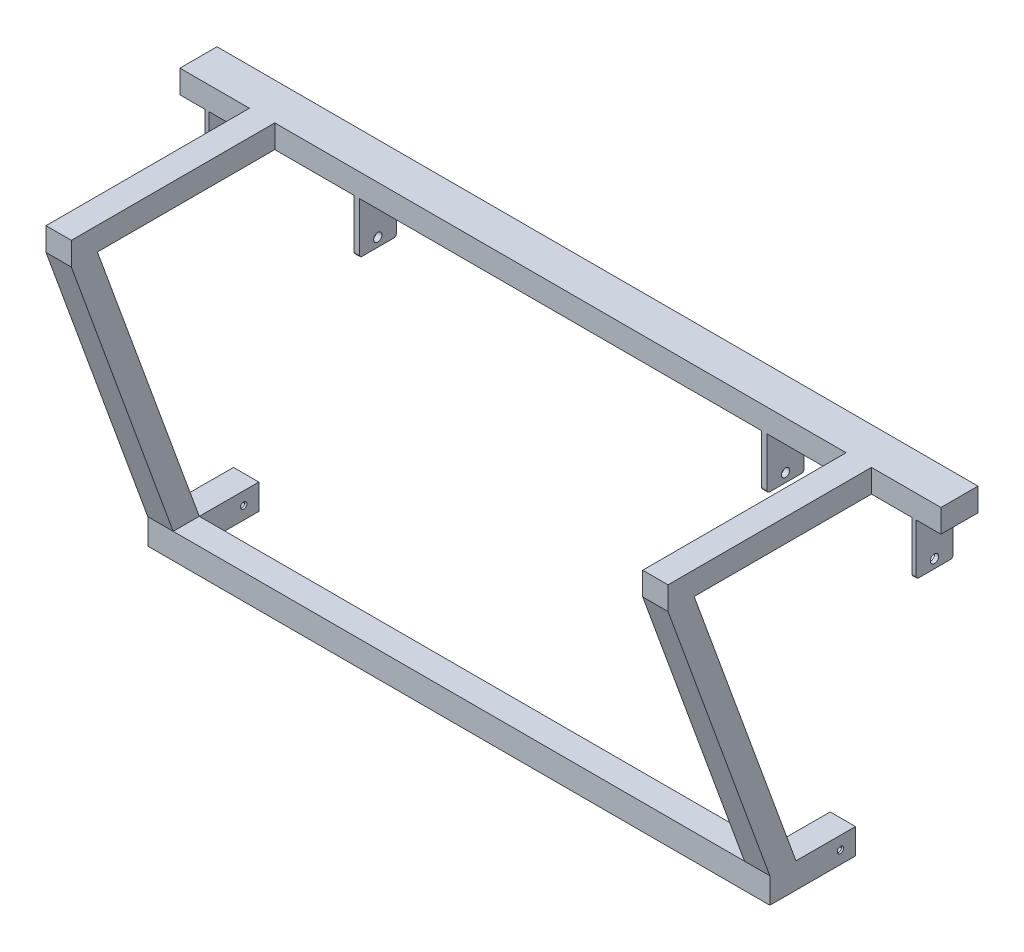
from build123d import *

# Parameters (mm, degrees)
SKETCH1_W            = 1150
SKETCH1_H            = 56
BOSS_EXTRUDE1_DEPTH  = 35
SKETCH2_W            = 38.3
SKETCH2_H            = 35
BOSS_EXTRUDE2_DEPTH  = 268
BOSS_EXTRUDE3_DEPTH  = 38.3
BOSS_EXTRUDE4_DEPTH  = 38.3
SKETCH5_W            = 38.3
SKETCH5_H            = 39.42449842
BOSS_EXTRUDE5_DEPTH  = 38.5
BOSS_EXTRUDE6_DEPTH  = 901.7
SKETCH8_W            = 38.3
SKETCH8_H            = 38.5
BOSS_EXTRUDE7_DEPTH  = 90
SHELL2_START         = -467
SHELL2_OUTLINE_W     = 29
SHELL2_OUTLINE_H     = 50
SHELL2_DEPTH         = 934
SHELL2_2_DEPTH       = 32.3
SHELL2_START_2       = 434.7
SHELL2_3_DEPTH       = 32.3
SHELL2_START_3       = -575
SHELL2_4_OUTLINE_W   = 29
SHELL2_4_OUTLINE_H   = 50
SHELL2_4_DEPTH       = 1147
SKETCH13_W           = 50
SKETCH13_H           = 29
BOSS_EXTRUDE8_DEPTH  = 3
SKETCH14_R           = 4.75
CUT_EXTRUDE1_DEPTH   = 1390
SKETCH15_W           = 8.185813993
SKETCH15_H           = 78
SKETCH15_W_2         = 6
BOSS_EXTRUDE10_DEPTH = 56
FILLET2_R            = 4
SKETCH16_R           = 6.3
CUT_EXTRUDE2_DEPTH   = 1390


# Read off the part's stored shape, not the designer's step: Shell2
with BuildPart() as part:
    # Sketch1 → Boss-Extrude1 (new body)
    with BuildSketch(Plane(origin=(0, 0, 0), x_dir=(1, 0, 0), z_dir=(0, 1, 0))):
        Rectangle(SKETCH1_W, SKETCH1_H)
    extrude(amount=-BOSS_EXTRUDE1_DEPTH)

    # Sketch2 → Boss-Extrude2 (add)
    with BuildSketch(Plane.XY.offset(28)):
        with Locations((-450.85, -17.5)):
            Rectangle(SKETCH2_W, SKETCH2_H)
        with Locations((450.85, -17.5)):
            Rectangle(SKETCH2_W, SKETCH2_H)
    extrude(amount=BOSS_EXTRUDE2_DEPTH)

    # Sketch3 → Boss-Extrude3 (add)
    with BuildSketch(Plane.ZY.offset(470)):
        Polygon((296, -35), (142.090935503, -457.861679354), (181.515376734, -457.794527623), (335.4, -35), (335.4, 0), (296, 0), align=None)
    extrude(amount=-BOSS_EXTRUDE3_DEPTH)

    # Sketch4 → Boss-Extrude4 (add)
    with BuildSketch(Plane.ZY.offset(-431.7)):
        Polygon((296, 0), (335.4, 0), (335.4, -35), (181.515376734, -457.794527623), (142.090935503, -457.861679354), (296, -35), align=None)
    extrude(amount=-BOSS_EXTRUDE4_DEPTH)

    # Sketch5 → Boss-Extrude5 (add)
    with BuildSketch(Plane(origin=(0, -458.102374067, 0.780286699), x_dir=(1, 0, 0), z_dir=(0, -0.9999985493842727, 0.0017032995480483616))):
        with Locations((450.85, 161.023103003)):
            Rectangle(SKETCH5_W, SKETCH5_H)
    extrude(amount=BOSS_EXTRUDE5_DEPTH)

    # Sketch6 → Boss-Extrude6 (add)
    with BuildSketch(Plane.ZY.offset(-431.7)):
        Polygon((142.090935503, -457.861679354), (181.515376734, -457.794527623), (181.580953767, -496.294471775), (142.156512536, -496.361623505), align=None)
    extrude(amount=BOSS_EXTRUDE6_DEPTH)

    # Sketch8 → Boss-Extrude7 (add)
    with BuildSketch(Plane(origin=(0, 0.240694713, 141.310648805), x_dir=(-1, 0, 0), z_dir=(0, -0.0017032995480483616, -0.9999985493842727))):
        with Locations((-450.85, -477.353038599)):
            Rectangle(SKETCH8_W, SKETCH8_H)
        with Locations((450.85, -477.353038599)):
            Rectangle(SKETCH8_W, SKETCH8_H)
    extrude(amount=BOSS_EXTRUDE7_DEPTH)

    # Shell2 outline → Shell2 (cut)
    with BuildSketch(Plane.YZ.offset(SHELL2_START)):
        Polygon((-493.356517958, 145.151398286), (-460.856565103, 145.09604105), (-460.79963317, 178.520490985), (-493.299586025, 178.57584822), align=None)
        with Locations((-17.5, 0)):
            Rectangle(SHELL2_OUTLINE_W, SHELL2_OUTLINE_H)
    extrude(amount=SHELL2_DEPTH, mode=Mode.SUBTRACT)

    # Shell2 2 outline → Shell2 2 (cut)
    with BuildSketch(Plane.YZ.offset(SHELL2_START)):
        Polygon((-460.79963317, 178.520490985), (-460.856565103, 145.09604105), (-493.356517958, 145.151398286), (-493.509814917, 55.151528841), (-461.009862062, 55.096171606), (-460.858103494, 144.192859625), (-32, 300.28444402), (-32, 25), (-3, 25), (-3, 332.4), (-34.471019058, 332.4), (-457.268022568, 178.514475585), align=None)
    extrude(amount=SHELL2_2_DEPTH, mode=Mode.SUBTRACT)

    # Shell2 3 outline → Shell2 3 (cut)
    with BuildSketch(Plane.YZ.offset(SHELL2_START_2)):
        Polygon((-460.79963317, 178.520490985), (-460.856565103, 145.09604105), (-493.356517958, 145.151398286), (-493.509814917, 55.151528841), (-461.009862062, 55.096171606), (-460.858103494, 144.192859625), (-32, 300.28444402), (-32, 25), (-3, 25), (-3, 332.4), (-34.471019058, 332.4), (-457.268022568, 178.514475585), align=None)
    extrude(amount=SHELL2_3_DEPTH, mode=Mode.SUBTRACT)

    # Shell2 4 outline → Shell2 4 (cut)
    with BuildSketch(Plane.YZ.offset(SHELL2_START_3)):
        with Locations((-17.5, 0)):
            Rectangle(SHELL2_4_OUTLINE_W, SHELL2_4_OUTLINE_H)
    extrude(amount=SHELL2_4_DEPTH, mode=Mode.SUBTRACT)

    # Sketch13 → Boss-Extrude8 (add)
    with BuildSketch(Plane.ZY.offset(575)):
        with Locations((0, -17.5)):
            Rectangle(SKETCH13_W, SKETCH13_H)
    extrude(amount=-BOSS_EXTRUDE8_DEPTH)

    # Sketch14 → Cut-Extrude1 (cut)
    with BuildSketch(Plane(origin=(470, 0, 0), x_dir=(0, 0, -1), z_dir=(1, 0, 0))):
        with Locations((-74.873854575, -477.264948389)):
            Circle(SKETCH14_R)
    extrude(amount=-CUT_EXTRUDE1_DEPTH, mode=Mode.SUBTRACT)

    # Sketch15 → Boss-Extrude10 (add)
    with BuildSketch(Plane(origin=(0, 0, -28), x_dir=(-1, 0, 0), z_dir=(0, 0, -1))):
        with Locations((308.092906997, -74)):
            Rectangle(SKETCH15_W, SKETCH15_H)
        with Locations((534.3, -74)):
            Rectangle(SKETCH15_W_2, SKETCH15_H)
        with Locations((-534.3, -74)):
            Rectangle(SKETCH15_W_2, SKETCH15_H)
        with Locations((-308.092906997, -74)):
            Rectangle(SKETCH15_W, SKETCH15_H)
    extrude(amount=-BOSS_EXTRUDE10_DEPTH)

    # Fillet2
    fillet2_edges = [part.edges().sort_by_distance(p)[0] for p in [
        (-308.092906997, -113, -28),
        (-308.092906997, -113, 28),
        (-534.3, -113, -28),
        (-534.3, -113, 28),
        (534.3, -113, -28),
        (534.3, -113, 28),
        (308.092906997, -113, -28),
        (308.092906997, -113, 28),
    ]]
    fillet(fillet2_edges, radius=FILLET2_R)

    # Sketch16 → Cut-Extrude2 (cut)
    with BuildSketch(Plane(origin=(537.3, 0, 0), x_dir=(0, 0, -1), z_dir=(1, 0, 0))):
        with Locations((0, -99.8)):
            Circle(SKETCH16_R)
    extrude(amount=-CUT_EXTRUDE2_DEPTH, mode=Mode.SUBTRACT)


solid = part.part
